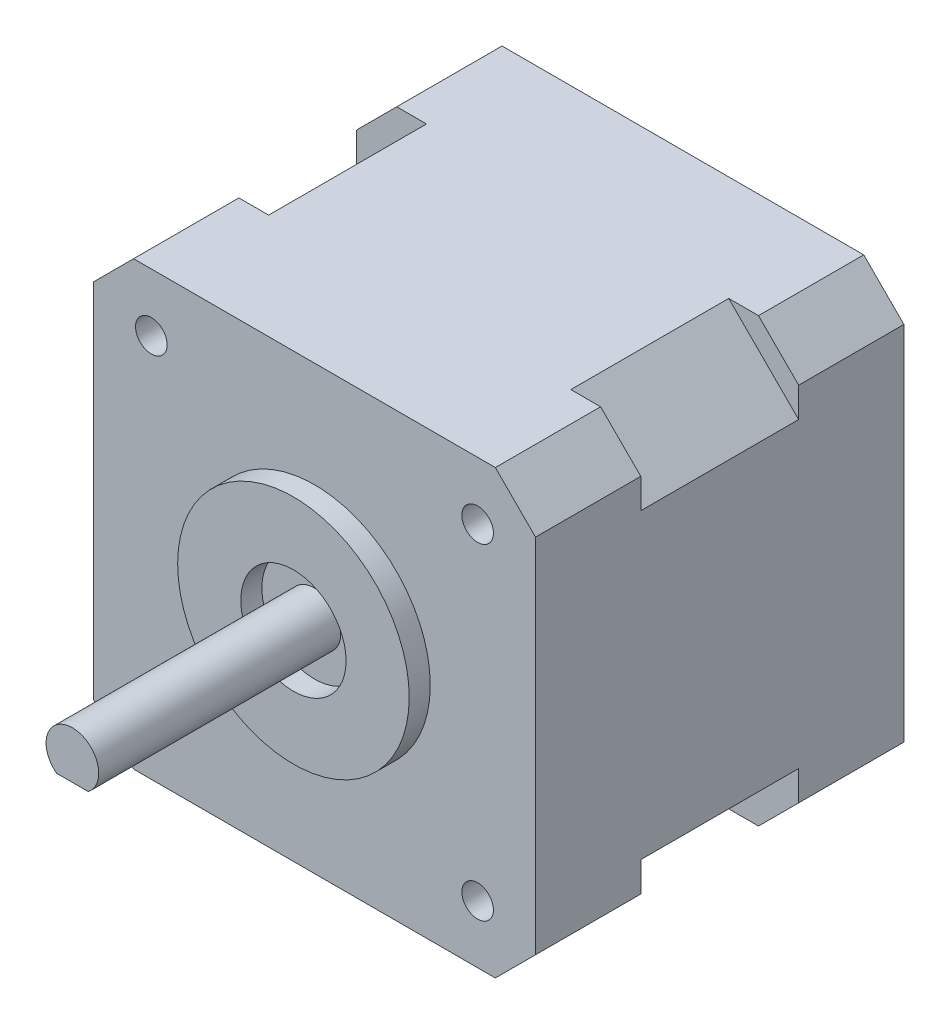
from build123d import *

# Parameters (mm, degrees)
EXTRUDE_1_DEPTH     = 35
SKETCH_2_R          = 11
SKETCH_2_R_2        = 5
EXTRUDE_2_DEPTH     = 2
SKETCH_3_R          = 2.5
EXTRUDE_3_DEPTH     = 23
CUT_EXTRUDE_START   = -18
CUT_EXTRUDE_1_DEPTH = 18
SKETCH_5_R          = 1.5
CUT_EXTRUDE_2_DEPTH = 5
SKETCH_6_R          = 4.5
CUT_EXTRUDE_3_DEPTH = 3
SKETCH_7_W          = 77.18999879
SKETCH_7_H          = 61.964077954
CUT_EXTRUDE_4_DEPTH = 15


with BuildPart() as part:
    # 草图1 → 凸台-拉伸1 (new body)
    with BuildSketch(Plane.XY):
        Polygon((-17.183766184, 21), (17.183766184, 21), (21, 17.183766184), (21, -17.183766184), (17.183766184, -21), (-17.183766184, -21), (-21, -17.183766184), (-21, 17.183766184), align=None)
    extrude(amount=EXTRUDE_1_DEPTH)

    # 草图2 → 凸台-拉伸2 (add)
    with BuildSketch(Plane.XY.offset(35)):
        Circle(SKETCH_2_R)
        Circle(SKETCH_2_R_2, mode=Mode.SUBTRACT)
    extrude(amount=EXTRUDE_2_DEPTH)

    # 草图3 → 凸台-拉伸3 (add)
    with BuildSketch(Plane.XY.offset(35)):
        Circle(SKETCH_3_R)
    extrude(amount=EXTRUDE_3_DEPTH)

    # 草图4 → 切除-拉伸1 (cut)
    with BuildSketch(Plane.XY.offset(58).offset(CUT_EXTRUDE_START)):
        with BuildLine():
            Line((1.5, -2), (-1.5, -2))
            ThreePointArc((-1.5, -2), (0, -2.5), (1.5, -2))
        make_face()
    extrude(amount=CUT_EXTRUDE_1_DEPTH, mode=Mode.SUBTRACT)

    # 草图5 → 切除-拉伸2 (cut)
    with BuildSketch(Plane.XY.offset(35)):
        with Locations((-15.5, 15.5)):
            Circle(SKETCH_5_R)
        with Locations((15.5, 15.5)):
            Circle(SKETCH_5_R)
        with Locations((15.5, -15.5)):
            Circle(SKETCH_5_R)
        with Locations((-15.5, -15.5)):
            Circle(SKETCH_5_R)
    extrude(amount=-CUT_EXTRUDE_2_DEPTH, mode=Mode.SUBTRACT)

    # 草图6 → 切除-拉伸3 (cut)
    with BuildSketch(Plane(origin=(0, 0, 0), x_dir=(-1, 0, 0), z_dir=(0, 0, -1))):
        Circle(SKETCH_6_R)
    extrude(amount=-CUT_EXTRUDE_3_DEPTH, mode=Mode.SUBTRACT)

    # 草图7 → 切除-拉伸4 (cut)
    with BuildSketch(Plane(origin=(0, 0, 10), x_dir=(-1, 0, 0), z_dir=(0, 0, -1))):
        Rectangle(SKETCH_7_W, SKETCH_7_H)
        Polygon((14.355339059, 21), (21, 14.355339059), (21, -14.355339059), (14.355339059, -21), (-14.355339059, -21), (-21, -14.355339059), (-21, 14.355339059), (-14.355339059, 21), align=None, mode=Mode.SUBTRACT)
    extrude(amount=-CUT_EXTRUDE_4_DEPTH, mode=Mode.SUBTRACT)


solid = part.part
